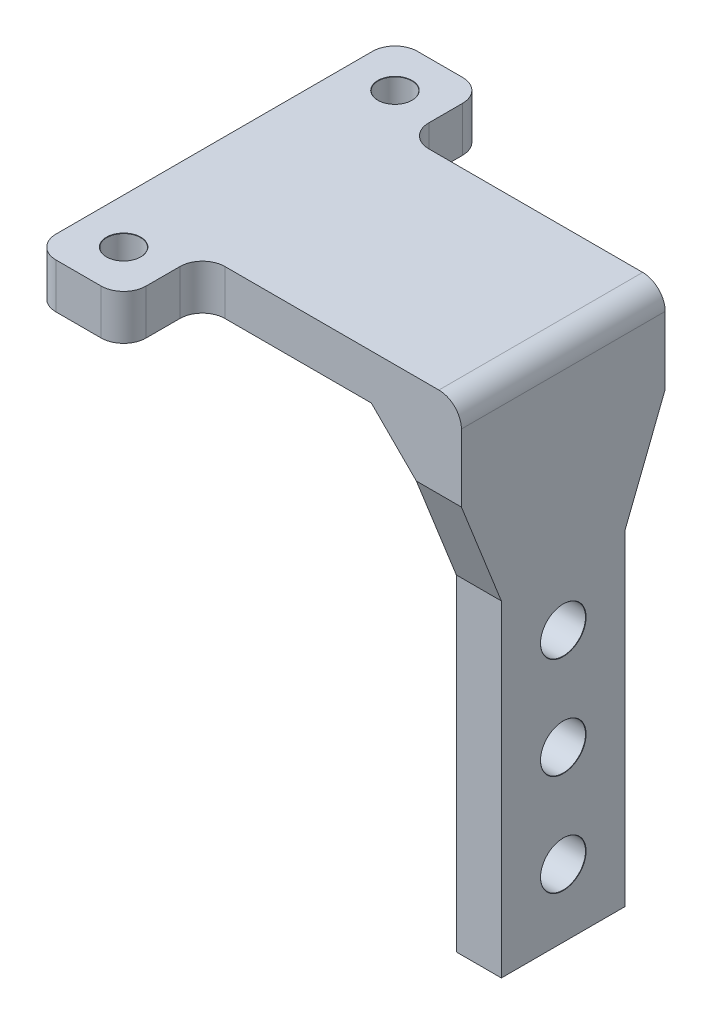
from build123d import *

# Parameters (mm, degrees)
BOSS_EXTRUDE1_DEPTH             = 4
FILLET1_R                       = 2
F_3_0MM_DOWEL_HOLE1_D           = 3
F_3_0MM_DOWEL_HOLE1_CSINK_D     = 3.05
F_3_0MM_DOWEL_HOLE1_CSINK_ANGLE = 90
SKETCH4_W                       = 4
SKETCH4_H                       = 18.1
BOSS_EXTRUDE2_DEPTH             = 42
CHAMFER1_SIZE                   = 4
FILLET2_R                       = 2
F_4_0MM_DOWEL_HOLE1_D           = 4
F_4_0MM_DOWEL_HOLE1_CSINK_D     = 4.05
F_4_0MM_DOWEL_HOLE1_CSINK_ANGLE = 90
CUT_EXTRUDE1_DEPTH              = 53.446186706
CUT_EXTRUDE1_DEPTH_BACK         = 53.446186706
CUT_EXTRUDE2_DEPTH              = 53.446186706
CUT_EXTRUDE2_DEPTH_BACK         = 53.446186706


with BuildPart() as part:
    # Sketch1 → Boss-Extrude1 (new body)
    with BuildSketch(Plane(origin=(0, 0, 0), x_dir=(1, 0, 0), z_dir=(0, 1, 0))):
        Polygon((0, 16.05), (0, -16.05), (8, -16.05), (8, -9.05), (31, -9.05), (31, 9.05), (8, 9.05), (8, 16.05), align=None)
    extrude(amount=BOSS_EXTRUDE1_DEPTH)

    # Fillet1
    fillet1_edges = [part.edges().sort_by_distance(p)[0] for p in [
        (0, 2, -16.05),
        (8, 2, -9.05),
        (8, 2, -16.05),
        (0, 2, 16.05),
        (8, 2, 16.05),
        (8, 2, 9.05),
    ]]
    fillet(fillet1_edges, radius=FILLET1_R)

    # Ø3.0mm Dowel Hole1 (through all)
    with Locations(Plane(origin=(0, 4, 0), x_dir=(1, 0, 0), z_dir=(0, 1, 0))):
        with Locations((4, 12.05), (4, -12.05)):
            CounterSinkHole(F_3_0MM_DOWEL_HOLE1_D / 2, F_3_0MM_DOWEL_HOLE1_CSINK_D / 2, counter_sink_angle=F_3_0MM_DOWEL_HOLE1_CSINK_ANGLE)

    # Sketch4 → Boss-Extrude2 (add)
    with BuildSketch(Plane(origin=(0, 0, 0), x_dir=(-1, 0, 0), z_dir=(0, -1, 0))):
        with Locations((-29, 0)):
            Rectangle(SKETCH4_W, SKETCH4_H)
    extrude(amount=BOSS_EXTRUDE2_DEPTH)

    # Chamfer1
    chamfer1_edges = [part.edges().sort_by_distance(p)[0] for p in [
        (27, 0, 0),
    ]]
    chamfer(chamfer1_edges, length=CHAMFER1_SIZE)

    # Fillet2
    fillet2_edges = [part.edges().sort_by_distance(p)[0] for p in [
        (31, 4, 0),
    ]]
    fillet(fillet2_edges, radius=FILLET2_R)

    # Ø4.0mm Dowel Hole1 (through all)
    with Locations(Plane(origin=(31, 0, 0), x_dir=(0, 0, -1), z_dir=(1, 0, 0))):
        with Locations((0, -36), (0, -27), (0, -18)):
            CounterSinkHole(F_4_0MM_DOWEL_HOLE1_D / 2, F_4_0MM_DOWEL_HOLE1_CSINK_D / 2, counter_sink_angle=F_4_0MM_DOWEL_HOLE1_CSINK_ANGLE)

    # Sketch11 → Cut-Extrude1 (cut, two sides: drawn at the far end of the back side and taken through both)
    with BuildSketch(Plane.ZY.offset(-27).offset(-CUT_EXTRUDE1_DEPTH_BACK)):
        Polygon((-9.05, -4), (-5.5, -13), (-5.5, -42), (-9.05, -42), align=None)
    extrude(amount=CUT_EXTRUDE1_DEPTH + CUT_EXTRUDE1_DEPTH_BACK, mode=Mode.SUBTRACT)

    # Sketch12 → Cut-Extrude2 (cut, two sides: drawn at the far end of the back side and taken through both)
    with BuildSketch(Plane.ZY.offset(-27).offset(-CUT_EXTRUDE2_DEPTH_BACK)):
        Polygon((9.05, -4), (5.5, -13), (5.5, -42), (9.05, -42), align=None)
    extrude(amount=CUT_EXTRUDE2_DEPTH + CUT_EXTRUDE2_DEPTH_BACK, mode=Mode.SUBTRACT)


solid = part.part
